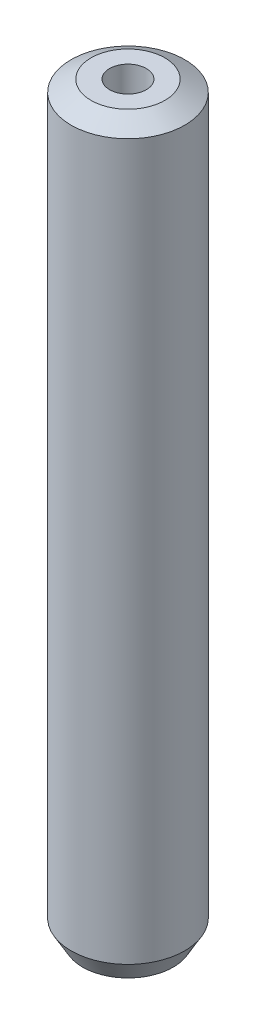
from build123d import *
from OCP.BRepFilletAPI import BRepFilletAPI_MakeChamfer

# Parameters (mm, degrees)
SKETCH1_R           = 20
BOSS_EXTRUDE1_DEPTH = 262.723898034
SKETCH2_R           = 6.466538736
CUT_EXTRUDE1_DEPTH  = 265.242022771
CHAMFER1_SIZE       = 4.046977822
CHAMFER1_SIZE2      = 7.009571205


with BuildPart() as part:
    # Sketch1 → Boss-Extrude1 (new body)
    with BuildSketch(Plane(origin=(0, 0, 0), x_dir=(1, 0, 0), z_dir=(0, 1, 0))):
        Circle(SKETCH1_R)
    extrude(amount=BOSS_EXTRUDE1_DEPTH)

    # Sketch2 → Cut-Extrude1 (cut, through all)
    with BuildSketch(Plane(origin=(0, 0, 0), x_dir=(1, 0, 0), z_dir=(0, 1, 0))):
        Circle(SKETCH2_R)
    extrude(amount=CUT_EXTRUDE1_DEPTH, mode=Mode.SUBTRACT)

    # Chamfer1: one chamfer whose edges measure the first distance from different faces: ONE call of the kernel's chamfer builder (chamfer() names one face for all edges)
    chamfer1_edges_1 = [part.edges().sort_by_distance(p)[0] for p in [
        (-20, 262.723898034, 0),
    ]]
    chamfer1_side_1 = [part.faces().sort_by_distance(p)[0] for p in [
        (-20, 131.361949017, 0),
    ]]
    chamfer1_edges_2 = [part.edges().sort_by_distance(p)[0] for p in [
        (-20, 0, 0),
    ]]
    chamfer1_side_2 = [part.faces().sort_by_distance(p)[0] for p in [
        (-19.434314575, 0, 0),
    ]]
    chamfer1 = BRepFilletAPI_MakeChamfer(part.part.solid().wrapped)
    for e in chamfer1_edges_1:
        chamfer1.Add(CHAMFER1_SIZE, CHAMFER1_SIZE2, e.wrapped, chamfer1_side_1[0].wrapped)  # the first distance lies on this face
    for e in chamfer1_edges_2:
        chamfer1.Add(CHAMFER1_SIZE, CHAMFER1_SIZE2, e.wrapped, chamfer1_side_2[0].wrapped)  # the first distance lies on this face
    add(Compound.cast(chamfer1.Shape()), mode=Mode.REPLACE)


solid = part.part
